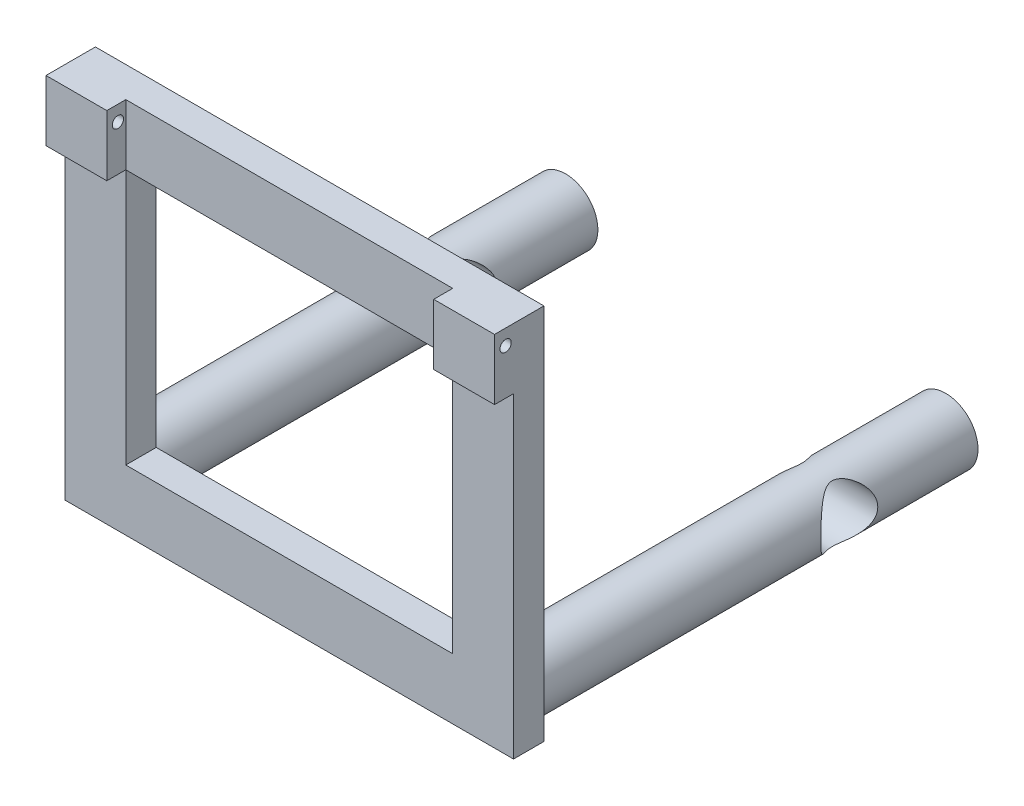
from build123d import *

# Parameters (mm, degrees)
SKETCH1_W               = 1180.071112
SKETCH1_H               = 992.574724554
SKETCH1_W_2             = 860.071112
SKETCH1_H_2             = 672.574724554
BOSS_EXTRUDE2_DEPTH     = 80
SKETCH2_W               = 160
SKETCH2_H               = 160
BOSS_EXTRUDE3_DEPTH     = 50
CUT_EXTRUDE1_DEPTH      = 1455.1049711
CUT_EXTRUDE1_DEPTH_BACK = 1455.1049711
SKETCH3_R               = 14.854674555
SKETCH4_R               = 85
BOSS_EXTRUDE4_DEPTH     = 1147
SKETCH5_R               = 75
CUT_EXTRUDE2_DEPTH      = 1854.869382998


with BuildPart() as part:
    # Sketch1 → Boss-Extrude2 (new body)
    with BuildSketch(Plane.XY):
        with Locations((-366.347627568, -343.327690947)):
            Rectangle(SKETCH1_W, SKETCH1_H)
        with Locations((-366.347627568, -343.327690947)):
            Rectangle(SKETCH1_W_2, SKETCH1_H_2, mode=Mode.SUBTRACT)
    extrude(amount=BOSS_EXTRUDE2_DEPTH)

    # Sketch2 → Boss-Extrude3 (add)
    with BuildSketch(Plane.XY.offset(80)):
        with Locations((-876.383183568, 72.95967133)):
            Rectangle(SKETCH2_W, SKETCH2_H)
        with Locations((143.687928432, 72.95967133)):
            Rectangle(SKETCH2_W, SKETCH2_H)
    extrude(amount=BOSS_EXTRUDE3_DEPTH)

    # Sketch3 → Cut-Extrude1 (cut, two sides: drawn at the far end of the back side and taken through both)
    with BuildSketch(Plane(origin=(223.687928432, 0, 0), x_dir=(0, 0, -1), z_dir=(1, 0, 0)).offset(-CUT_EXTRUDE1_DEPTH_BACK)):
        with Locations((-100.843841858, 112.404893927)):
            Circle(SKETCH3_R)
    extrude(amount=CUT_EXTRUDE1_DEPTH + CUT_EXTRUDE1_DEPTH_BACK, mode=Mode.SUBTRACT)

    # Sketch4 → Boss-Extrude4 (add)
    with BuildSketch(Plane(origin=(0, 0, 0), x_dir=(-1, 0, 0), z_dir=(0, 0, -1))):
        with Locations((-133.687928432, -749.615053224)):
            Circle(SKETCH4_R)
        with Locations((866.383183568, -749.615053224)):
            Circle(SKETCH4_R)
    extrude(amount=BOSS_EXTRUDE4_DEPTH)

    # Sketch5 → Cut-Extrude2 (cut, through all)
    with BuildSketch(Plane(origin=(233.687928432, 0, 0), x_dir=(0, 0, -1), z_dir=(1, 0, 0))):
        with Locations((808.343239866, -749.615053224)):
            Circle(SKETCH5_R)
    extrude(amount=-CUT_EXTRUDE2_DEPTH, mode=Mode.SUBTRACT)


solid = part.part
